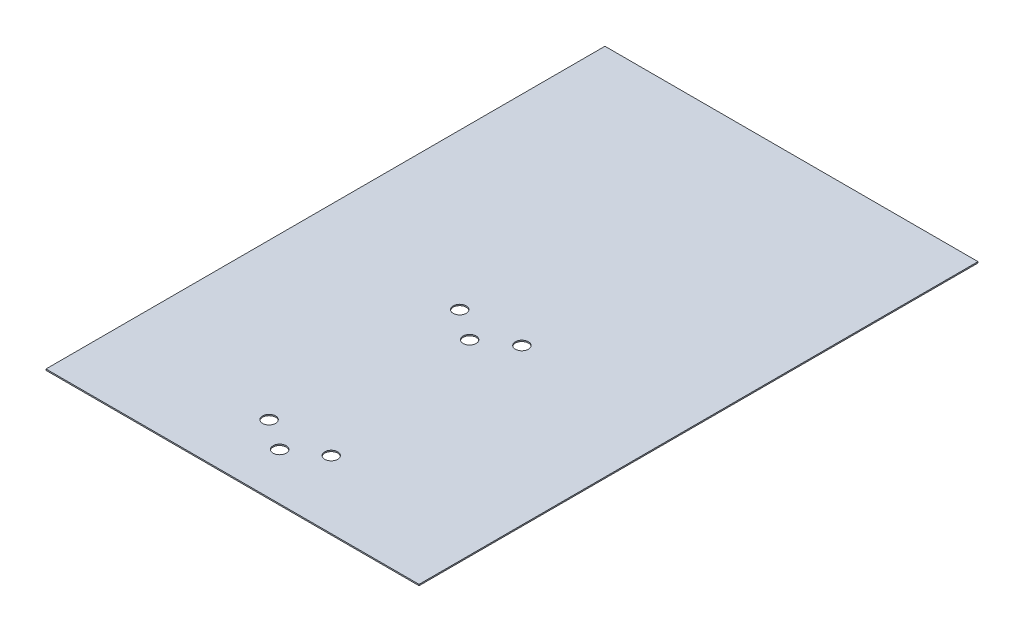
from build123d import *

# Parameters (mm, degrees)
SKETCH1_W           = 76.2
SKETCH1_H           = 114.173
BOSS_EXTRUDE1_DEPTH = 0.254
SKETCH2_R           = 1.3335
CUT_EXTRUDE1_DEPTH  = 2.54


with BuildPart() as part:
    # Sketch1 → Boss-Extrude1 (new body)
    with BuildSketch(Plane(origin=(0, 0, 0), x_dir=(1, 0, 0), z_dir=(0, 1, 0))):
        with Locations((38.1, 57.0865)):
            Rectangle(SKETCH1_W, SKETCH1_H)
    extrude(amount=BOSS_EXTRUDE1_DEPTH)

    # Sketch2 → Cut-Extrude1 (cut)
    with BuildSketch(Plane(origin=(0, 0.254, 0), x_dir=(1, 0, 0), z_dir=(0, 1, 0))):
        with Locations((31.75, 13.8176)):
            Circle(SKETCH2_R)
        with Locations((44.45, 13.8176)):
            Circle(SKETCH2_R)
        with Locations((38.1, 9.6266)):
            Circle(SKETCH2_R)
        with Locations((31.75, 52.7558)):
            Circle(SKETCH2_R)
        with Locations((44.45, 52.7558)):
            Circle(SKETCH2_R)
        with Locations((38.1, 48.4378)):
            Circle(SKETCH2_R)
    extrude(amount=-CUT_EXTRUDE1_DEPTH, mode=Mode.SUBTRACT)


solid = part.part
